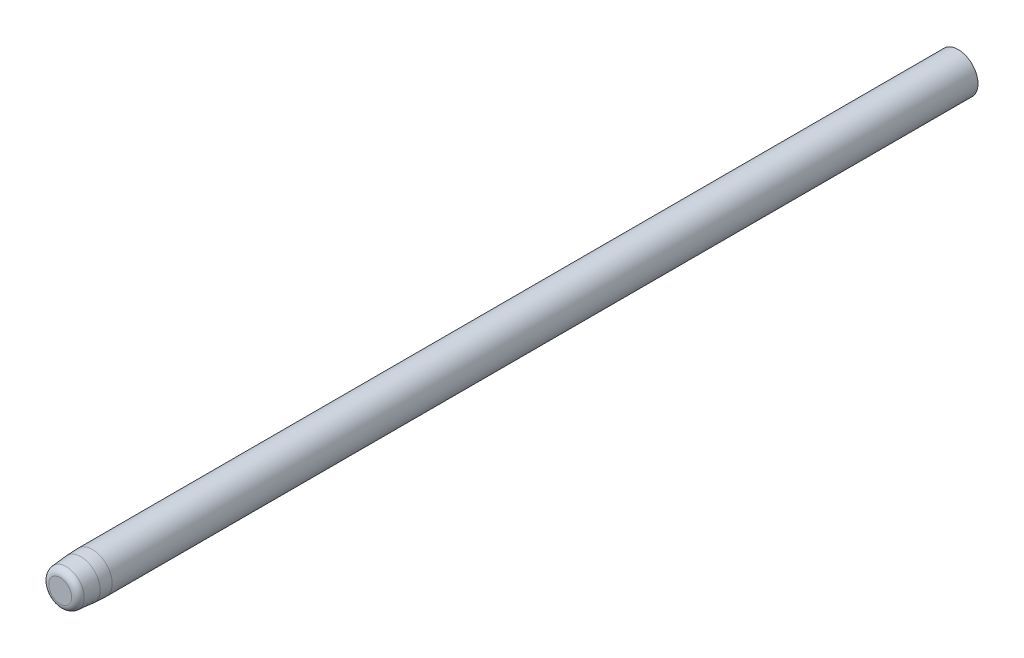
from build123d import *

# Parameters (mm, degrees)
SKETCH2_R           = 1.905
BOSS_EXTRUDE1_DEPTH = 86.36
CHAMFER1_SIZE       = 2.54
CHAMFER1_SIZE2      = 0.222221205
FILLET1_R           = 12.7
FILLET2_R           = 0.635


with BuildPart() as part:
    # Sketch2 → Boss-Extrude1 (new body)
    with BuildSketch(Plane.XY):
        Circle(SKETCH2_R)
    extrude(amount=BOSS_EXTRUDE1_DEPTH)

    # Chamfer1
    chamfer1_edges = [part.edges().sort_by_distance(p)[0] for p in [
        (-1.905, 0, 86.36),
    ]]
    chamfer1_side = [part.faces().sort_by_distance(p)[0] for p in [
        (-1.905, 0, 43.18),
    ]]
    chamfer(chamfer1_edges, length=CHAMFER1_SIZE, length2=CHAMFER1_SIZE2, reference=chamfer1_side[0])

    # Fillet1
    # the kernel refuses this fillet: 12.7 mm, written as the material it takes off along each edge
    with BuildSketch(Plane(origin=(0, 0, 83.82), x_dir=(1, 0, 0), z_dir=(0, -1, 0))) as fillet1_piece_1:
        with BuildLine():
            CenterArc((1.905 - FILLET1_R, -FILLET1_R * 0.0436609429085), FILLET1_R, 0, 5)
            Line((1.905 - FILLET1_R * 0.00380530190825, FILLET1_R * 0.0434947998391), (1.905, 0))
            Line((1.905, 0), (1.905, -FILLET1_R * 0.0436609429085))
        make_face()
    revolve(axis=Axis((0, 0, 83.82), (0, 0, 1)), mode=Mode.SUBTRACT)

    # Fillet2
    fillet2_edges = [part.edges().sort_by_distance(p)[0] for p in [
        (-1.682778795, 0, 86.36),
    ]]
    fillet(fillet2_edges, radius=FILLET2_R)


solid = part.part
